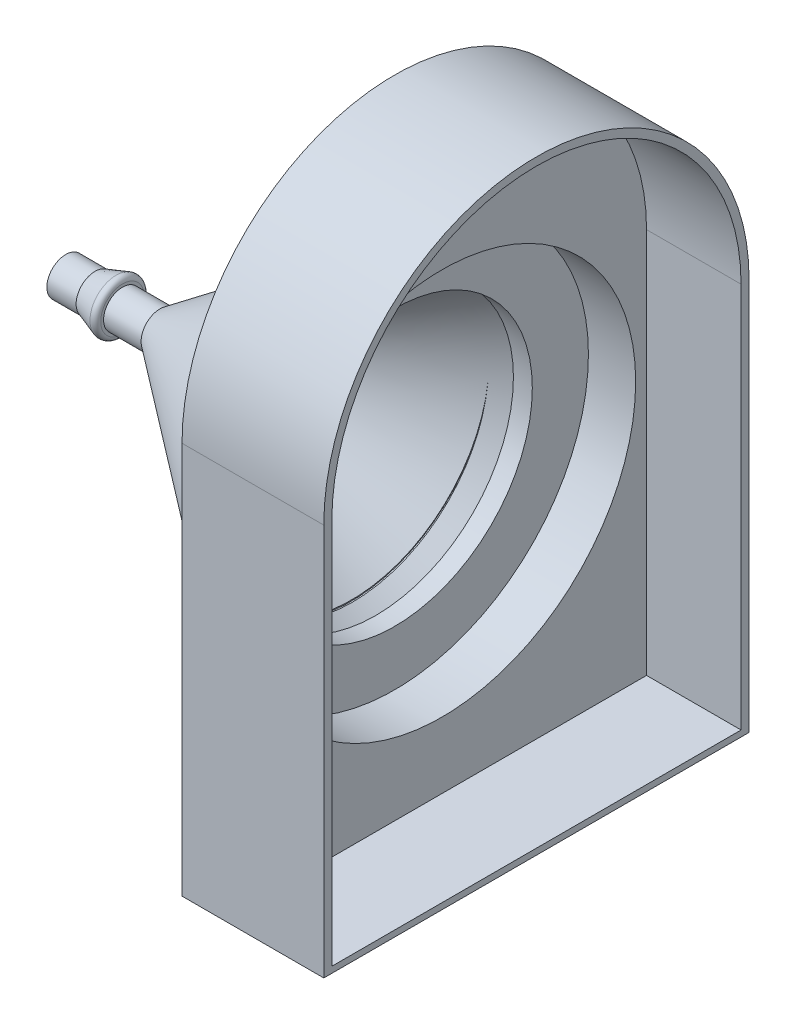
from build123d import *

# Parameters (mm, degrees)
BOSS_EXTRUDE1_DEPTH = 19.05
CUT_EXTRUDE1_DEPTH  = 12.7
SKETCH4_R           = 26.035
CUT_EXTRUDE2_DEPTH  = 65.145109252
SKETCH7_R           = 18.496466633
CUT_EXTRUDE3_DEPTH  = 5.842
SKETCH8_R           = 2.54
CUT_EXTRUDE4_DEPTH  = 60.96
SKETCH9_R           = 2.54
SKETCH9_R_2         = 1.27
EXTRUDE_THIN1_DEPTH = 12.7
FILLET1_R           = 0.635


# Read off the part's stored shape, not the designer's step: Revolve-Thin4
with BuildPart() as part:
    # Sketch2 → Boss-Extrude1 (new body)
    with BuildSketch(Plane(origin=(0, 0, 0), x_dir=(0, 0, -1), z_dir=(1, 0, 0))):
        with BuildLine():
            Line((-28.575, 27.431914001), (-28.575, -25.273085999))
            Line((-28.575, -25.273085999), (28.575, -25.273085999))
            Line((28.575, -25.273085999), (28.575, 27.431914001))
            ThreePointArc((28.575, 27.431914001), (0, 56.006914001), (-28.575, 27.431914001))
        make_face()
    extrude(amount=BOSS_EXTRUDE1_DEPTH)

    # Sketch3 → Cut-Extrude1 (cut)
    with BuildSketch(Plane(origin=(19.05, 0, 0), x_dir=(0, 0, -1), z_dir=(1, 0, 0))):
        with BuildLine():
            Line((27.4955, 27.431914001), (27.4955, -24.447585999))
            Line((27.4955, -24.447585999), (-27.4955, -24.447585999))
            Line((-27.4955, -24.447585999), (-27.4955, 27.431914001))
            ThreePointArc((-27.4955, 27.431914001), (0, 54.927414001), (27.4955, 27.431914001))
        make_face()
    extrude(amount=-CUT_EXTRUDE1_DEPTH, mode=Mode.SUBTRACT)

    # Sketch4 → Cut-Extrude2 (cut, through all)
    with BuildSketch(Plane(origin=(6.35, 0, 0), x_dir=(0, 0, -1), z_dir=(1, 0, 0))):
        with Locations((0, 10.477414001)):
            Circle(SKETCH4_R)
    extrude(amount=-CUT_EXTRUDE2_DEPTH, mode=Mode.SUBTRACT)


with BuildPart() as body_2:
    # Revolve-Thin4 outline → Revolve-Thin4 (revolve)
    with BuildSketch(Plane(origin=(0, 10.477414001, 0), x_dir=(0, 1, 0), z_dir=(0, 0, -1))):
        Polygon((0, 0), (0, -31.75), (2.38125, -31.75), (26.035, 0), align=None)
        Polygon((2.54, -27.285374101), (2.54, -2.54), (20.975303705, -2.54), align=None, mode=Mode.SUBTRACT)
    revolve(axis=Axis((0, 10.477414001, 0), (1, 0, 0)))

    # Sketch7 → Cut-Extrude3 (cut)
    with BuildSketch(Plane(origin=(0, 0, 0), x_dir=(0, 0, -1), z_dir=(1, 0, 0))):
        with Locations((0, 10.322694798)):
            Circle(SKETCH7_R)
    extrude(amount=-CUT_EXTRUDE3_DEPTH, mode=Mode.SUBTRACT)

    # Sketch8 → Cut-Extrude4 (cut)
    with BuildSketch(Plane(origin=(-5.842, 0, 0), x_dir=(0, 0, -1), z_dir=(1, 0, 0))):
        with Locations((0, 10.477414001)):
            Circle(SKETCH8_R)
    extrude(amount=-CUT_EXTRUDE4_DEPTH, mode=Mode.SUBTRACT)


with BuildPart() as body_3:
    # Sketch9 → Extrude-Thin1 (new body)
    with BuildSketch(Plane(origin=(-31.496, 0, 0), x_dir=(0, 0, -1), z_dir=(1, 0, 0))):
        with Locations((0, 10.477414001)):
            Circle(SKETCH9_R)
        with Locations((0, 10.477414001)):
            Circle(SKETCH9_R_2, mode=Mode.SUBTRACT)
    extrude(amount=-EXTRUDE_THIN1_DEPTH)

    # Sketch10 → Revolve1 (revolve)
    with BuildSketch(Plane(origin=(0, 0, 0), x_dir=(-1, 0, 0), z_dir=(0, 0, -1)), mode=Mode.PRIVATE) as revolve1_sk:
        Polygon((40.264616111, 7.937414001), (36.576, 6.667414001), (36.576, 7.937414001), align=None)
    revolve(revolve1_sk.sketch.rotate(Axis((0, 10.477414001, 0), (1, 0, 0)), 90), axis=Axis((0, 10.477414001, 0), (1, 0, 0)))

    # Fillet1
    fillet1_edges = [body_3.edges().sort_by_distance(p)[0] for p in [
        (-36.576, 10.477414001, 3.81),
    ]]
    fillet(fillet1_edges, radius=FILLET1_R)


solid = Compound([part.part, body_2.part, body_3.part])
